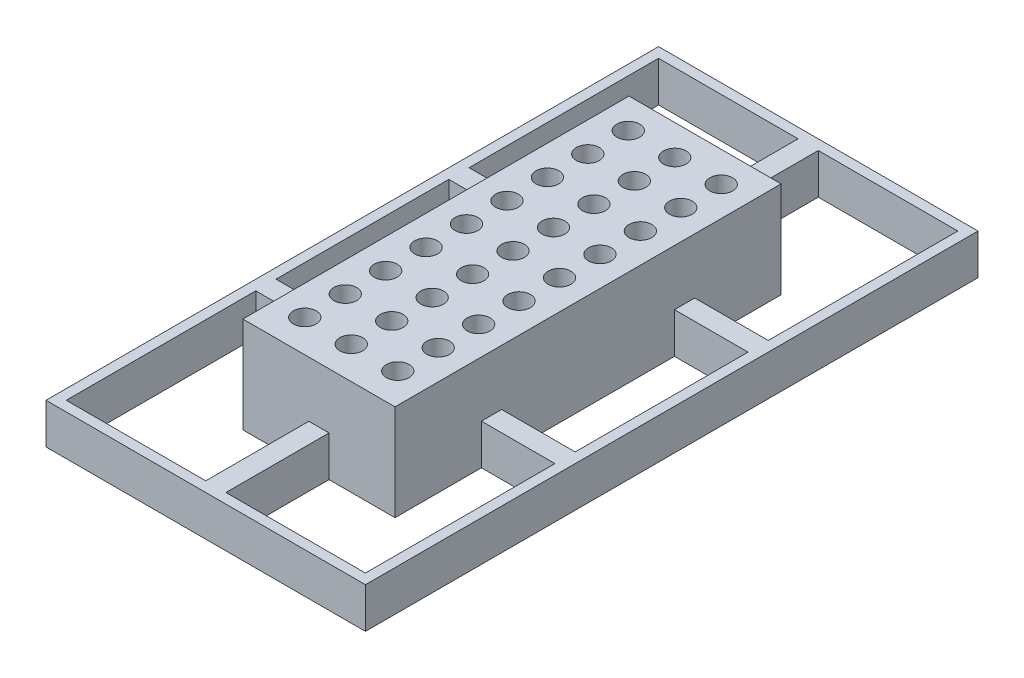
from build123d import *

# Parameters (mm, degrees)
SKETCH1_W                = 158
SKETCH1_H                = 303
SKETCH1_W_2              = 148
SKETCH1_H_2              = 293
BOSS_EXTRUDE1_DEPTH      = 20
BOSS_EXTRUDE2_DEPTH      = 27.5
BOSS_EXTRUDE2_DEPTH_BACK = 20
SKETCH2_R                = 5.65
SKETCH4_OUTSIDE_W        = 229.002
SKETCH4_OUTSIDE_H        = 374.002
SKETCH4_OUTSIDE_W_2      = 75.25
SKETCH4_OUTSIDE_H_2      = 191
CUT_EXTRUDE1_DEPTH       = 27.5
SHELL1_OUTLINE_W         = 71.25
SHELL1_OUTLINE_H         = 187
SHELL1_OUTLINE_R         = 7.65
SHELL1_DEPTH             = 45.5
SHELL1_2_OUTLINE_W       = 154
SHELL1_2_OUTLINE_H       = 299
SHELL1_2_DEPTH           = 18
SKETCH3_R                = 5.65
SKETCH3_R_2              = 4.5
BOSS_EXTRUDE3_DEPTH      = 2


# Read off the part's stored shape, not the designer's step: Shell1
with BuildPart() as part:
    # Sketch1 → Boss-Extrude1 (new body)
    with BuildSketch(Plane(origin=(0, 0, 0), x_dir=(1, 0, 0), z_dir=(0, 1, 0))):
        Rectangle(SKETCH1_W, SKETCH1_H)
        Rectangle(SKETCH1_W_2, SKETCH1_H_2, mode=Mode.SUBTRACT)
    extrude(amount=BOSS_EXTRUDE1_DEPTH)

    # Sketch2 → Boss-Extrude2 (add, two sides: drawn at the far end of the back side and taken through both)
    with BuildSketch(Plane(origin=(0, 20, 0), x_dir=(1, 0, 0), z_dir=(0, 1, 0)).offset(-BOSS_EXTRUDE2_DEPTH_BACK)):
        Polygon((-74, 52.75), (-37.625, 52.75), (-37.625, 95.5), (-5, 95.5), (-5, 146.5), (5, 146.5), (5, 95.5), (37.625, 95.5), (37.625, 52.75), (74, 52.75), (74, 42.75), (37.625, 42.75), (37.625, -42.75), (74, -42.75), (74, -52.75), (37.625, -52.75), (37.625, -95.5), (5, -95.5), (5, -146.5), (-5, -146.5), (-5, -95.5), (-37.625, -95.5), (-37.625, -52.75), (-74, -52.75), (-74, -42.75), (-37.625, -42.75), (-37.625, 42.75), (-74, 42.75), align=None)
        with Locations(Location((-22.995, 80.5, 0), (0, 0, 270))):
            Circle(SKETCH2_R, mode=Mode.SUBTRACT)
        with Locations(Location((0, 80.5, 0), (0, 0, 270))):
            Circle(SKETCH2_R, mode=Mode.SUBTRACT)
        with Locations(Location((22.995, 80.5, 0), (0, 0, 270))):
            Circle(SKETCH2_R, mode=Mode.SUBTRACT)
        with Locations(Location((-22.995, 60.5, 0), (0, 0, 270))):
            Circle(SKETCH2_R, mode=Mode.SUBTRACT)
        with Locations(Location((0, 60.5, 0), (0, 0, 270))):
            Circle(SKETCH2_R, mode=Mode.SUBTRACT)
        with Locations(Location((22.995, 60.5, 0), (0, 0, 270))):
            Circle(SKETCH2_R, mode=Mode.SUBTRACT)
        with Locations(Location((-22.995, 40.5, 0), (0, 0, 270))):
            Circle(SKETCH2_R, mode=Mode.SUBTRACT)
        with Locations(Location((0, 40.5, 0), (0, 0, 270))):
            Circle(SKETCH2_R, mode=Mode.SUBTRACT)
        with Locations(Location((22.995, 40.5, 0), (0, 0, 270))):
            Circle(SKETCH2_R, mode=Mode.SUBTRACT)
        with Locations(Location((-22.995, 20.5, 0), (0, 0, 270))):
            Circle(SKETCH2_R, mode=Mode.SUBTRACT)
        with Locations(Location((0, 20.5, 0), (0, 0, 270))):
            Circle(SKETCH2_R, mode=Mode.SUBTRACT)
        with Locations(Location((22.995, 20.5, 0), (0, 0, 270))):
            Circle(SKETCH2_R, mode=Mode.SUBTRACT)
        with Locations(Location((-22.995, 0.5, 0), (0, 0, 270))):
            Circle(SKETCH2_R, mode=Mode.SUBTRACT)
        with Locations(Location((0, 0.5, 0), (0, 0, 270))):
            Circle(SKETCH2_R, mode=Mode.SUBTRACT)
        with Locations(Location((22.995, 0.5, 0), (0, 0, 270))):
            Circle(SKETCH2_R, mode=Mode.SUBTRACT)
        with Locations(Location((-22.995, -19.5, 0), (0, 0, 270))):
            Circle(SKETCH2_R, mode=Mode.SUBTRACT)
        with Locations(Location((0, -19.5, 0), (0, 0, 270))):
            Circle(SKETCH2_R, mode=Mode.SUBTRACT)
        with Locations(Location((22.995, -19.5, 0), (0, 0, 270))):
            Circle(SKETCH2_R, mode=Mode.SUBTRACT)
        with Locations(Location((-22.995, -39.5, 0), (0, 0, 270))):
            Circle(SKETCH2_R, mode=Mode.SUBTRACT)
        with Locations(Location((0, -39.5, 0), (0, 0, 270))):
            Circle(SKETCH2_R, mode=Mode.SUBTRACT)
        with Locations(Location((22.995, -39.5, 0), (0, 0, 270))):
            Circle(SKETCH2_R, mode=Mode.SUBTRACT)
        with Locations(Location((-22.995, -59.5, 0), (0, 0, 270))):
            Circle(SKETCH2_R, mode=Mode.SUBTRACT)
        with Locations(Location((0, -59.5, 0), (0, 0, 270))):
            Circle(SKETCH2_R, mode=Mode.SUBTRACT)
        with Locations(Location((22.995, -59.5, 0), (0, 0, 270))):
            Circle(SKETCH2_R, mode=Mode.SUBTRACT)
        with Locations(Location((-22.995, -79.5, 0), (0, 0, 270))):
            Circle(SKETCH2_R, mode=Mode.SUBTRACT)
        with Locations(Location((0, -79.5, 0), (0, 0, 270))):
            Circle(SKETCH2_R, mode=Mode.SUBTRACT)
        with Locations(Location((22.995, -79.5, 0), (0, 0, 270))):
            Circle(SKETCH2_R, mode=Mode.SUBTRACT)
    extrude(amount=BOSS_EXTRUDE2_DEPTH + BOSS_EXTRUDE2_DEPTH_BACK)

    # Sketch4 outside → Cut-Extrude1 (cut)
    with BuildSketch(Plane(origin=(0, 47.5, 0), x_dir=(1, 0, 0), z_dir=(0, 1, 0))):
        Rectangle(SKETCH4_OUTSIDE_W, SKETCH4_OUTSIDE_H)
        Rectangle(SKETCH4_OUTSIDE_W_2, SKETCH4_OUTSIDE_H_2, mode=Mode.SUBTRACT)
    extrude(amount=-CUT_EXTRUDE1_DEPTH, mode=Mode.SUBTRACT)

    # Shell1 outline → Shell1 (cut)
    with BuildSketch(Plane(origin=(0, 0, 0), x_dir=(1, 0, 0), z_dir=(0, 1, 0))):
        Rectangle(SHELL1_OUTLINE_W, SHELL1_OUTLINE_H)
        with Locations((-22.995, -79.5)):
            Circle(SHELL1_OUTLINE_R, mode=Mode.SUBTRACT)
        with Locations((-22.995, -59.5)):
            Circle(SHELL1_OUTLINE_R, mode=Mode.SUBTRACT)
        with Locations((-22.995, -39.5)):
            Circle(SHELL1_OUTLINE_R, mode=Mode.SUBTRACT)
        with Locations((-22.995, -19.5)):
            Circle(SHELL1_OUTLINE_R, mode=Mode.SUBTRACT)
        with Locations((0, -79.5)):
            Circle(SHELL1_OUTLINE_R, mode=Mode.SUBTRACT)
        with Locations((22.995, -79.5)):
            Circle(SHELL1_OUTLINE_R, mode=Mode.SUBTRACT)
        with Locations((0, -59.5)):
            Circle(SHELL1_OUTLINE_R, mode=Mode.SUBTRACT)
        with Locations((0, -39.5)):
            Circle(SHELL1_OUTLINE_R, mode=Mode.SUBTRACT)
        with Locations((22.995, -59.5)):
            Circle(SHELL1_OUTLINE_R, mode=Mode.SUBTRACT)
        with Locations((22.995, -39.5)):
            Circle(SHELL1_OUTLINE_R, mode=Mode.SUBTRACT)
        with Locations((0, -19.5)):
            Circle(SHELL1_OUTLINE_R, mode=Mode.SUBTRACT)
        with Locations((22.995, -19.5)):
            Circle(SHELL1_OUTLINE_R, mode=Mode.SUBTRACT)
        with Locations((-22.995, 0.5)):
            Circle(SHELL1_OUTLINE_R, mode=Mode.SUBTRACT)
        with Locations((-22.995, 20.5)):
            Circle(SHELL1_OUTLINE_R, mode=Mode.SUBTRACT)
        with Locations((-22.995, 40.5)):
            Circle(SHELL1_OUTLINE_R, mode=Mode.SUBTRACT)
        with Locations((-22.995, 60.5)):
            Circle(SHELL1_OUTLINE_R, mode=Mode.SUBTRACT)
        with Locations((-22.995, 80.5)):
            Circle(SHELL1_OUTLINE_R, mode=Mode.SUBTRACT)
        with Locations((0, 0.5)):
            Circle(SHELL1_OUTLINE_R, mode=Mode.SUBTRACT)
        with Locations((0, 20.5)):
            Circle(SHELL1_OUTLINE_R, mode=Mode.SUBTRACT)
        with Locations((22.995, 0.5)):
            Circle(SHELL1_OUTLINE_R, mode=Mode.SUBTRACT)
        with Locations((22.995, 20.5)):
            Circle(SHELL1_OUTLINE_R, mode=Mode.SUBTRACT)
        with Locations((0, 40.5)):
            Circle(SHELL1_OUTLINE_R, mode=Mode.SUBTRACT)
        with Locations((0, 60.5)):
            Circle(SHELL1_OUTLINE_R, mode=Mode.SUBTRACT)
        with Locations((22.995, 40.5)):
            Circle(SHELL1_OUTLINE_R, mode=Mode.SUBTRACT)
        with Locations((22.995, 60.5)):
            Circle(SHELL1_OUTLINE_R, mode=Mode.SUBTRACT)
        with Locations((0, 80.5)):
            Circle(SHELL1_OUTLINE_R, mode=Mode.SUBTRACT)
        with Locations((22.995, 80.5)):
            Circle(SHELL1_OUTLINE_R, mode=Mode.SUBTRACT)
    extrude(amount=SHELL1_DEPTH, mode=Mode.SUBTRACT)

    # Shell1 2 outline → Shell1 2 (cut)
    with BuildSketch(Plane(origin=(0, 0, 0), x_dir=(1, 0, 0), z_dir=(0, 1, 0))):
        Rectangle(SHELL1_2_OUTLINE_W, SHELL1_2_OUTLINE_H)
        Polygon((-76, 148.5), (-3, 148.5), (-3, 93.5), (3, 93.5), (3, 148.5), (76, 148.5), (76, 50.75), (35.625, 50.75), (35.625, 44.75), (76, 44.75), (76, -44.75), (35.625, -44.75), (35.625, -50.75), (76, -50.75), (76, -148.5), (3, -148.5), (3, -93.5), (-3, -93.5), (-3, -148.5), (-76, -148.5), (-76, -50.75), (-35.625, -50.75), (-35.625, -44.75), (-76, -44.75), (-76, 44.75), (-35.625, 44.75), (-35.625, 50.75), (-76, 50.75), align=None, mode=Mode.SUBTRACT)
    extrude(amount=SHELL1_2_DEPTH, mode=Mode.SUBTRACT)

    # Sketch3 → Boss-Extrude3 (add)
    # profile 1 of 27: a face of its own
    with BuildSketch(Plane.XZ):
        with Locations(Location((-22.995, 79.5, 0), (0, 0, 270))):
            Circle(SKETCH3_R)
        with Locations(Location((-22.995, 79.5, 0), (0, 0, 270))):
            Circle(SKETCH3_R_2, mode=Mode.SUBTRACT)
    # profile 2 of 27: a face of its own
    with BuildSketch(Plane.XZ):
        with Locations(Location((22.995, 79.5, 0), (0, 0, 270))):
            Circle(SKETCH3_R)
        with Locations(Location((22.995, 79.5, 0), (0, 0, 270))):
            Circle(SKETCH3_R_2, mode=Mode.SUBTRACT)
    # profile 3 of 27: a face of its own
    with BuildSketch(Plane.XZ):
        with Locations(Location((0, 79.5, 0), (0, 0, 270))):
            Circle(SKETCH3_R)
        with Locations(Location((0, 79.5, 0), (0, 0, 270))):
            Circle(SKETCH3_R_2, mode=Mode.SUBTRACT)
    # profile 4 of 27: a face of its own
    with BuildSketch(Plane.XZ):
        with Locations(Location((-22.995, 59.5, 0), (0, 0, 270))):
            Circle(SKETCH3_R)
        with Locations(Location((-22.995, 59.5, 0), (0, 0, 270))):
            Circle(SKETCH3_R_2, mode=Mode.SUBTRACT)
    # profile 5 of 27: a face of its own
    with BuildSketch(Plane.XZ):
        with Locations(Location((0, 59.5, 0), (0, 0, 270))):
            Circle(SKETCH3_R)
        with Locations(Location((0, 59.5, 0), (0, 0, 270))):
            Circle(SKETCH3_R_2, mode=Mode.SUBTRACT)
    # profile 6 of 27: a face of its own
    with BuildSketch(Plane.XZ):
        with Locations(Location((22.995, 59.5, 0), (0, 0, 270))):
            Circle(SKETCH3_R)
        with Locations(Location((22.995, 59.5, 0), (0, 0, 270))):
            Circle(SKETCH3_R_2, mode=Mode.SUBTRACT)
    # profile 7 of 27: a face of its own
    with BuildSketch(Plane.XZ):
        with Locations(Location((-22.995, 39.5, 0), (0, 0, 270))):
            Circle(SKETCH3_R)
        with Locations(Location((-22.995, 39.5, 0), (0, 0, 270))):
            Circle(SKETCH3_R_2, mode=Mode.SUBTRACT)
    # profile 8 of 27: a face of its own
    with BuildSketch(Plane.XZ):
        with Locations(Location((0, 39.5, 0), (0, 0, 270))):
            Circle(SKETCH3_R)
        with Locations(Location((0, 39.5, 0), (0, 0, 270))):
            Circle(SKETCH3_R_2, mode=Mode.SUBTRACT)
    # profile 9 of 27: a face of its own
    with BuildSketch(Plane.XZ):
        with Locations(Location((22.995, 39.5, 0), (0, 0, 270))):
            Circle(SKETCH3_R)
        with Locations(Location((22.995, 39.5, 0), (0, 0, 270))):
            Circle(SKETCH3_R_2, mode=Mode.SUBTRACT)
    # profile 10 of 27: a face of its own
    with BuildSketch(Plane.XZ):
        with Locations(Location((-22.995, 19.5, 0), (0, 0, 270))):
            Circle(SKETCH3_R)
        with Locations(Location((-22.995, 19.5, 0), (0, 0, 270))):
            Circle(SKETCH3_R_2, mode=Mode.SUBTRACT)
    # profile 11 of 27: a face of its own
    with BuildSketch(Plane.XZ):
        with Locations(Location((0, 19.5, 0), (0, 0, 270))):
            Circle(SKETCH3_R)
        with Locations(Location((0, 19.5, 0), (0, 0, 270))):
            Circle(SKETCH3_R_2, mode=Mode.SUBTRACT)
    # profile 12 of 27: a face of its own
    with BuildSketch(Plane.XZ):
        with Locations(Location((22.995, 19.5, 0), (0, 0, 270))):
            Circle(SKETCH3_R)
        with Locations(Location((22.995, 19.5, 0), (0, 0, 270))):
            Circle(SKETCH3_R_2, mode=Mode.SUBTRACT)
    # profile 13 of 27: a face of its own
    with BuildSketch(Plane.XZ):
        with Locations(Location((-22.995, -0.5, 0), (0, 0, 270))):
            Circle(SKETCH3_R)
        with Locations(Location((-22.995, -0.5, 0), (0, 0, 270))):
            Circle(SKETCH3_R_2, mode=Mode.SUBTRACT)
    # profile 14 of 27: a face of its own
    with BuildSketch(Plane.XZ):
        with Locations(Location((0, -0.5, 0), (0, 0, 270))):
            Circle(SKETCH3_R)
        with Locations(Location((0, -0.5, 0), (0, 0, 270))):
            Circle(SKETCH3_R_2, mode=Mode.SUBTRACT)
    # profile 15 of 27: a face of its own
    with BuildSketch(Plane.XZ):
        with Locations(Location((22.995, -0.5, 0), (0, 0, 270))):
            Circle(SKETCH3_R)
        with Locations(Location((22.995, -0.5, 0), (0, 0, 270))):
            Circle(SKETCH3_R_2, mode=Mode.SUBTRACT)
    # profile 16 of 27: a face of its own
    with BuildSketch(Plane.XZ):
        with Locations(Location((-22.995, -20.5, 0), (0, 0, 270))):
            Circle(SKETCH3_R)
        with Locations(Location((-22.995, -20.5, 0), (0, 0, 270))):
            Circle(SKETCH3_R_2, mode=Mode.SUBTRACT)
    # profile 17 of 27: a face of its own
    with BuildSketch(Plane.XZ):
        with Locations(Location((0, -20.5, 0), (0, 0, 270))):
            Circle(SKETCH3_R)
        with Locations(Location((0, -20.5, 0), (0, 0, 270))):
            Circle(SKETCH3_R_2, mode=Mode.SUBTRACT)
    # profile 18 of 27: a face of its own
    with BuildSketch(Plane.XZ):
        with Locations(Location((22.995, -20.5, 0), (0, 0, 270))):
            Circle(SKETCH3_R)
        with Locations(Location((22.995, -20.5, 0), (0, 0, 270))):
            Circle(SKETCH3_R_2, mode=Mode.SUBTRACT)
    # profile 19 of 27: a face of its own
    with BuildSketch(Plane.XZ):
        with Locations(Location((-22.995, -40.5, 0), (0, 0, 270))):
            Circle(SKETCH3_R)
        with Locations(Location((-22.995, -40.5, 0), (0, 0, 270))):
            Circle(SKETCH3_R_2, mode=Mode.SUBTRACT)
    # profile 20 of 27: a face of its own
    with BuildSketch(Plane.XZ):
        with Locations(Location((0, -40.5, 0), (0, 0, 270))):
            Circle(SKETCH3_R)
        with Locations(Location((0, -40.5, 0), (0, 0, 270))):
            Circle(SKETCH3_R_2, mode=Mode.SUBTRACT)
    # profile 21 of 27: a face of its own
    with BuildSketch(Plane.XZ):
        with Locations(Location((22.995, -40.5, 0), (0, 0, 270))):
            Circle(SKETCH3_R)
        with Locations(Location((22.995, -40.5, 0), (0, 0, 270))):
            Circle(SKETCH3_R_2, mode=Mode.SUBTRACT)
    # profile 22 of 27: a face of its own
    with BuildSketch(Plane.XZ):
        with Locations(Location((-22.995, -60.5, 0), (0, 0, 270))):
            Circle(SKETCH3_R)
        with Locations(Location((-22.995, -60.5, 0), (0, 0, 270))):
            Circle(SKETCH3_R_2, mode=Mode.SUBTRACT)
    # profile 23 of 27: a face of its own
    with BuildSketch(Plane.XZ):
        with Locations(Location((0, -60.5, 0), (0, 0, 270))):
            Circle(SKETCH3_R)
        with Locations(Location((0, -60.5, 0), (0, 0, 270))):
            Circle(SKETCH3_R_2, mode=Mode.SUBTRACT)
    # profile 24 of 27: a face of its own
    with BuildSketch(Plane.XZ):
        with Locations(Location((22.995, -60.5, 0), (0, 0, 270))):
            Circle(SKETCH3_R)
        with Locations(Location((22.995, -60.5, 0), (0, 0, 270))):
            Circle(SKETCH3_R_2, mode=Mode.SUBTRACT)
    # profile 25 of 27: a face of its own
    with BuildSketch(Plane.XZ):
        with Locations(Location((-22.995, -80.5, 0), (0, 0, 270))):
            Circle(SKETCH3_R)
        with Locations(Location((-22.995, -80.5, 0), (0, 0, 270))):
            Circle(SKETCH3_R_2, mode=Mode.SUBTRACT)
    # profile 26 of 27: a face of its own
    with BuildSketch(Plane.XZ):
        with Locations(Location((0, -80.5, 0), (0, 0, 270))):
            Circle(SKETCH3_R)
        with Locations(Location((0, -80.5, 0), (0, 0, 270))):
            Circle(SKETCH3_R_2, mode=Mode.SUBTRACT)
    # profile 27 of 27: a face of its own
    with BuildSketch(Plane.XZ):
        with Locations(Location((22.995, -80.5, 0), (0, 0, 270))):
            Circle(SKETCH3_R)
        with Locations(Location((22.995, -80.5, 0), (0, 0, 270))):
            Circle(SKETCH3_R_2, mode=Mode.SUBTRACT)
    extrude(amount=-BOSS_EXTRUDE3_DEPTH)


solid = part.part
